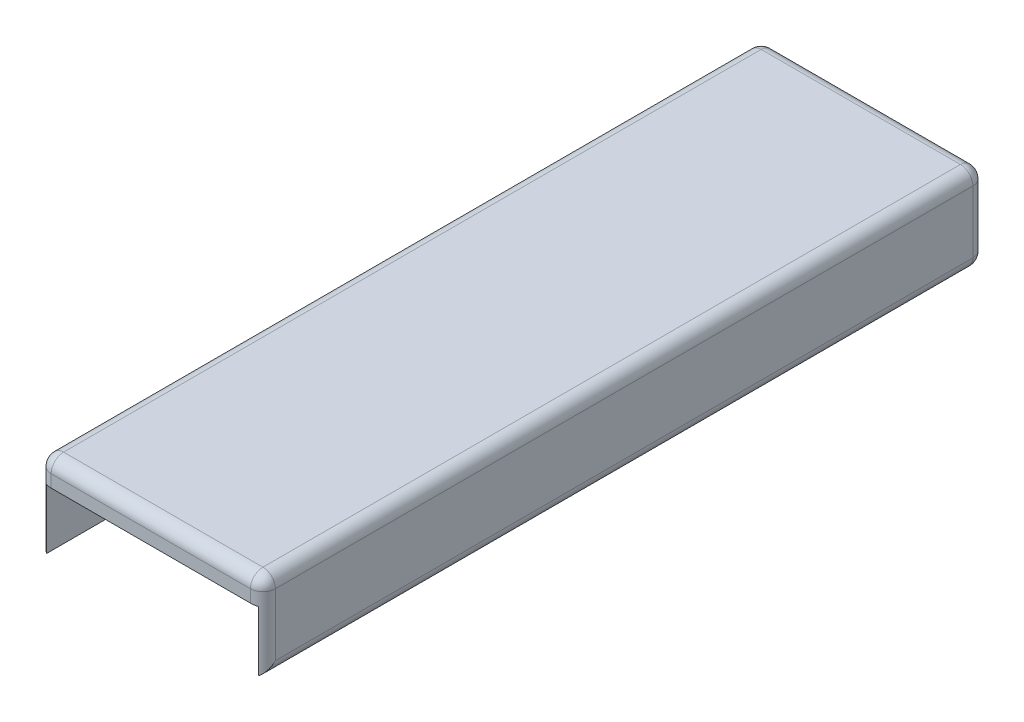
from build123d import *

# Parameters (mm, degrees)
SKETCH1_W           = 18
SKETCH1_H           = 58
BOSS_EXTRUDE1_DEPTH = 3.5
SKETCH2_W           = 17
SKETCH2_H           = 7
CUT_EXTRUDE1_DEPTH  = 5
CHAMFER1_SIZE2      = 3
CHAMFER1_SIZE       = 7
FILLET2_R           = 1
SKETCH3_W           = 8.5
SKETCH3_H           = 3.471291158
BOSS_EXTRUDE2_DEPTH = 0.1


# Some blends are built 0.0001 mm under size
with BuildPart() as part:
    # Sketch1 → Boss-Extrude1 (new, symmetric)
    with BuildSketch(Plane(origin=(0, 0, 0), x_dir=(1, 0, 0), z_dir=(0, 1, 0))):
        Rectangle(SKETCH1_W, SKETCH1_H)
    extrude(amount=BOSS_EXTRUDE1_DEPTH, both=True)

    # Sketch2 → Cut-Extrude1 (cut)
    with BuildSketch(Plane.XZ.offset(3.5)):
        with Locations((0, 25.5)):
            Rectangle(SKETCH2_W, SKETCH2_H)
    extrude(amount=-CUT_EXTRUDE1_DEPTH, mode=Mode.SUBTRACT)

    # Chamfer1
    chamfer1_edges = [part.edges().sort_by_distance(p)[0] for p in [
        (0, 1.5, 22),
    ]]
    chamfer1_side = [part.faces().sort_by_distance(p)[0] for p in [
        (0, 1.5, 22.06),
    ]]
    chamfer(chamfer1_edges, length=CHAMFER1_SIZE - 0.0001, length2=CHAMFER1_SIZE2 - 0.0001, reference=chamfer1_side[0])  # a hair under: the kernel refuses the full size

    # Fillet2
    # the kernel refuses this fillet: 1 mm, written as the material it takes off along each edge
    with BuildSketch(Plane(origin=(8, -2.5, -28), x_dir=(1, 0, 0), z_dir=(0, 0, -1))) as fillet2_piece_1_section:
        Polygon((0, 0), (FILLET2_R, 0), (FILLET2_R, FILLET2_R), (0, FILLET2_R), align=None)
    fillet2_piece_1 = extrude(amount=FILLET2_R, mode=Mode.PRIVATE)
    fillet2_piece_1 = fillet2_piece_1 - Plane(origin=(8, -2.5, -28), x_dir=(-0.7071067811865475, 0.7071067811865475, 0), z_dir=(0, 0, -1)) * Sphere(FILLET2_R, mode=Mode.PRIVATE)
    add(fillet2_piece_1, mode=Mode.SUBTRACT)
    with BuildSketch(Plane(origin=(-8, -2.5, -28), x_dir=(0, -1, 0), z_dir=(0, 0, -1))) as fillet2_piece_2_section:
        Polygon((0, 0), (FILLET2_R, 0), (FILLET2_R, FILLET2_R), (0, FILLET2_R), align=None)
    fillet2_piece_2 = extrude(amount=FILLET2_R, mode=Mode.PRIVATE)
    fillet2_piece_2 = fillet2_piece_2 - Plane(origin=(-8, -2.5, -28), x_dir=(0.7071067811865475, 0.7071067811865475, 0), z_dir=(0, 0, -1)) * Sphere(FILLET2_R, mode=Mode.PRIVATE)
    add(fillet2_piece_2, mode=Mode.SUBTRACT)
    with BuildSketch(Plane(origin=(-8, 2.5, -28), x_dir=(0, 1, 0), z_dir=(0, 0, -1))) as fillet2_piece_3_section:
        Polygon((0, 0), (FILLET2_R, 0), (FILLET2_R, -FILLET2_R), (0, -FILLET2_R), align=None)
    fillet2_piece_3 = extrude(amount=FILLET2_R, mode=Mode.PRIVATE)
    fillet2_piece_3 = fillet2_piece_3 - Plane(origin=(-8, 2.5, -28), x_dir=(0.7071067811865475, -0.7071067811865475, 0), z_dir=(0, 0, -1)) * Sphere(FILLET2_R, mode=Mode.PRIVATE)
    add(fillet2_piece_3, mode=Mode.SUBTRACT)
    with BuildSketch(Plane(origin=(8, 2.5, -28), x_dir=(1, 0, 0), z_dir=(0, 0, -1))) as fillet2_piece_4_section:
        Polygon((0, 0), (FILLET2_R, 0), (FILLET2_R, -FILLET2_R), (0, -FILLET2_R), align=None)
    fillet2_piece_4 = extrude(amount=FILLET2_R, mode=Mode.PRIVATE)
    fillet2_piece_4 = fillet2_piece_4 - Plane(origin=(8, 2.5, -28), x_dir=(-0.7071067811865475, -0.7071067811865475, 0), z_dir=(0, 0, -1)) * Sphere(FILLET2_R, mode=Mode.PRIVATE)
    add(fillet2_piece_4, mode=Mode.SUBTRACT)
    with BuildSketch(Plane(origin=(-8, 2.5, 28), x_dir=(0, 0, 1), z_dir=(0, 1, 0))) as fillet2_piece_5_section:
        Polygon((0, 0), (FILLET2_R, 0), (FILLET2_R, -FILLET2_R), (0, -FILLET2_R), align=None)
    fillet2_piece_5 = extrude(amount=FILLET2_R, mode=Mode.PRIVATE)
    fillet2_piece_5 = fillet2_piece_5 - Plane(origin=(-8, 2.5, 28), x_dir=(0.7071067811865475, 0, -0.7071067811865475), z_dir=(0, 1, 0)) * Sphere(FILLET2_R, mode=Mode.PRIVATE)
    add(fillet2_piece_5, mode=Mode.SUBTRACT)
    with BuildSketch(Plane(origin=(8, 2.5, 28), x_dir=(0, 1, 0), z_dir=(1, 0, 0))) as fillet2_piece_6_section:
        Polygon((0, 0), (FILLET2_R, 0), (FILLET2_R, FILLET2_R), (0, FILLET2_R), align=None)
    fillet2_piece_6 = extrude(amount=FILLET2_R, mode=Mode.PRIVATE)
    fillet2_piece_6 = fillet2_piece_6 - Plane(origin=(8, 2.5, 28), x_dir=(0, -0.7071067811865475, -0.7071067811865475), z_dir=(1, 0, 0)) * Sphere(FILLET2_R, mode=Mode.PRIVATE)
    add(fillet2_piece_6, mode=Mode.SUBTRACT)
    with BuildSketch(Plane(origin=(8, -3.5, -29), x_dir=(0, 0, 1), z_dir=(-1, 0, 0)), Plane(origin=(8, 3.5, -29), x_dir=(0, -1, 0), z_dir=(-1, 0, 0)), Plane(origin=(-8, 3.5, 29), x_dir=(0, -1, 0), z_dir=(1, 0, 0))) as fillet2_piece_7:
        with BuildLine():
            CenterArc((FILLET2_R, FILLET2_R), FILLET2_R, 180, 90)
            Line((0, FILLET2_R), (0, 0))
            Line((0, 0), (FILLET2_R, 0))
        make_face()
    extrude(amount=16, mode=Mode.SUBTRACT)
    with BuildSketch(Plane(origin=(-9, 2.5, -29), x_dir=(0, 0, 1), z_dir=(0, -1, 0))) as fillet2_piece_8:
        with BuildLine():
            CenterArc((FILLET2_R, -FILLET2_R), FILLET2_R, 90, 90)
            Line((0, -FILLET2_R), (0, 0))
            Line((0, 0), (FILLET2_R, 0))
        make_face()
    extrude(amount=5, mode=Mode.SUBTRACT)
    with BuildSketch(Plane(origin=(-9, -3.5, -28), x_dir=(1, 0, 0), z_dir=(0, 0, 1)), Plane(origin=(9, -3.5, 31.5), x_dir=(-1, 0, 0), z_dir=(0, 0, -1))) as fillet2_piece_9:
        with BuildLine():
            CenterArc((FILLET2_R, FILLET2_R), FILLET2_R, 180, 90)
            Line((0, FILLET2_R), (0, 0))
            Line((0, 0), (FILLET2_R, 0))
        make_face()
    extrude(amount=59.5, mode=Mode.SUBTRACT)
    with BuildSketch(Plane(origin=(-9, 3.5, -28), x_dir=(0, -1, 0), z_dir=(0, 0, 1)), Plane(origin=(9, 3.5, 28), x_dir=(0, -1, 0), z_dir=(0, 0, -1))) as fillet2_piece_10:
        with BuildLine():
            CenterArc((FILLET2_R, FILLET2_R), FILLET2_R, 180, 90)
            Line((0, FILLET2_R), (0, 0))
            Line((0, 0), (FILLET2_R, 0))
        make_face()
    extrude(amount=56, mode=Mode.SUBTRACT)
    with BuildSketch(Plane(origin=(9, -2.5, -29), x_dir=(-1, 0, 0), z_dir=(0, 1, 0))) as fillet2_piece_11:
        with BuildLine():
            CenterArc((FILLET2_R, FILLET2_R), FILLET2_R, 180, 90)
            Line((0, FILLET2_R), (0, 0))
            Line((0, 0), (FILLET2_R, 0))
        make_face()
    extrude(amount=5, mode=Mode.SUBTRACT)
    with BuildSketch(Plane(origin=(-9, 2.5, 29), x_dir=(1, 0, 0), z_dir=(0, -1, 0)), Plane(origin=(9, -6, 29), x_dir=(-1, 0, 0), z_dir=(0, 1, 0))) as fillet2_piece_12:
        with BuildLine():
            CenterArc((FILLET2_R, -FILLET2_R), FILLET2_R, 90, 90)
            Line((0, -FILLET2_R), (0, 0))
            Line((0, 0), (FILLET2_R, 0))
        make_face()
    extrude(amount=8.5, mode=Mode.SUBTRACT)

    # Sketch3 → Boss-Extrude2 (add)
    with BuildSketch(Plane.XY.offset(22)):
        with Locations((-4.25, -1.764354421)):
            Rectangle(SKETCH3_W, SKETCH3_H)
    extrude(amount=BOSS_EXTRUDE2_DEPTH)


solid = part.part
